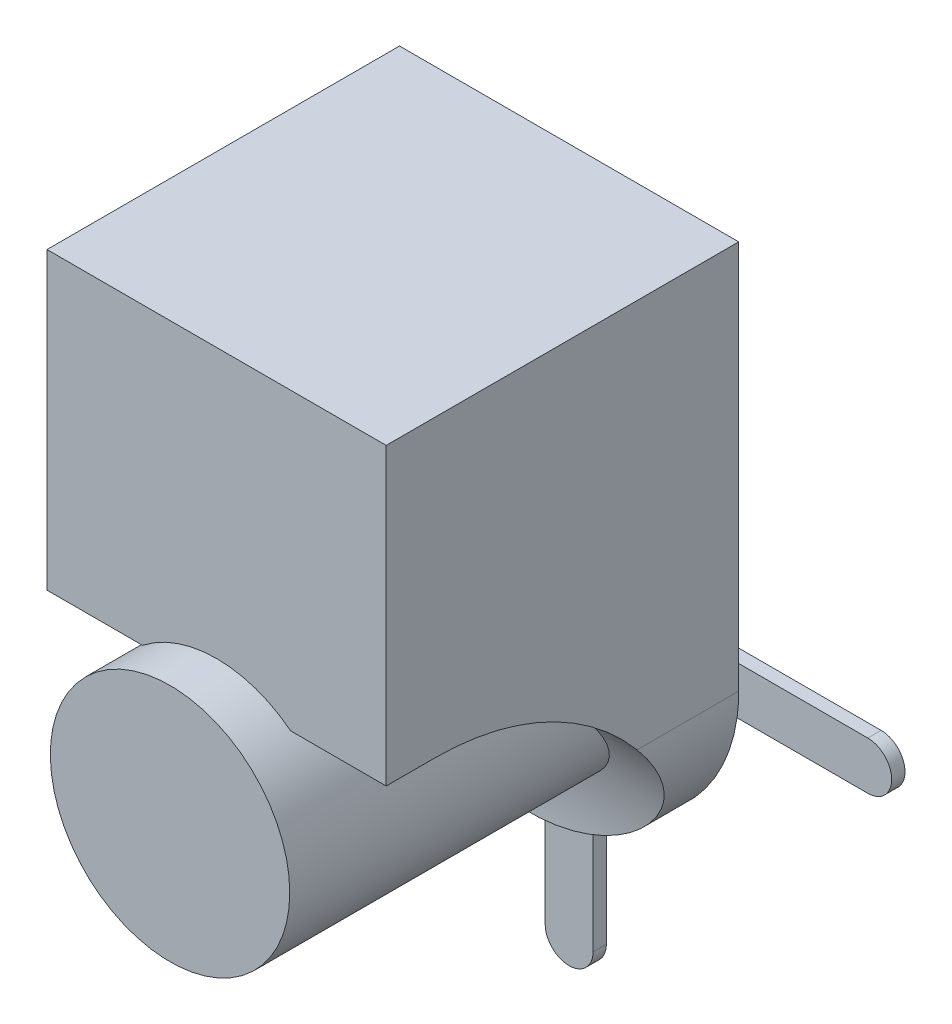
from build123d import *

# Parameters (mm, degrees)
SKETCH2_R               = 18
BOSS_EXTRUDE1_DEPTH     = 60
BOSS_EXTRUDE2_DEPTH     = 53
BOSS_EXTRUDE3_DEPTH     = 2
CUT_EXTRUDE3_DEPTH      = 97.822001632
CUT_EXTRUDE3_DEPTH_BACK = 97.822001632
BOSS_EXTRUDE4_START     = -56
SKETCH6_R               = 18
BOSS_EXTRUDE4_DEPTH     = 56


with BuildPart() as part:
    # Sketch2 → Boss-Extrude1 (new body)
    with BuildSketch(Plane.XY):
        Circle(SKETCH2_R)
    extrude(amount=BOSS_EXTRUDE1_DEPTH)

    # Sketch3 → Boss-Extrude2 (add)
    with BuildSketch(Plane.XY):
        with BuildLine():
            Line((-25.5, 0), (-25.5, 58.5))
            Line((-25.5, 58.5), (25.5, 58.5))
            Line((25.5, 58.5), (25.5, 0))
            ThreePointArc((25.5, 0), (0, -25.5), (-25.5, 0))
        make_face()
    extrude(amount=BOSS_EXTRUDE2_DEPTH)

    # Sketch4 → Boss-Extrude3 (add)
    with BuildSketch(Plane.XY):
        with BuildLine():
            Line((-3.6, 19.027416998), (-19.027416998, 3.6))
            Line((-19.027416998, 3.6), (-44.9, 3.6))
            ThreePointArc((-44.9, 3.6), (-48.5, 0), (-44.9, -3.6))
            Line((-44.9, -3.6), (-19.027416998, -3.6))
            Line((-19.027416998, -3.6), (-3.6, -19.027416998))
            Line((-3.6, -19.027416998), (-3.6, -44.9))
            ThreePointArc((-3.6, -44.9), (0, -48.5), (3.6, -44.9))
            Line((3.6, -44.9), (3.6, -19.027416998))
            Line((3.6, -19.027416998), (19.027416998, -3.6))
            Line((19.027416998, -3.6), (44.9, -3.6))
            ThreePointArc((44.9, -3.6), (48.5, 0), (44.9, 3.6))
            Line((44.9, 3.6), (19.027416998, 3.6))
            Line((19.027416998, 3.6), (3.6, 19.027416998))
            Line((3.6, 19.027416998), (3.6, 44.9))
            ThreePointArc((3.6, 44.9), (0, 48.5), (-3.6, 44.9))
            Line((-3.6, 44.9), (-3.6, 19.027416998))
        make_face()
    extrude(amount=-BOSS_EXTRUDE3_DEPTH)

    # Sketch5 → Cut-Extrude3 (cut, two sides: drawn at the far end of the back side and taken through both)
    with BuildSketch(Plane(origin=(0, 0, 0), x_dir=(0, 0, -1), z_dir=(1, 0, 0)).offset(-CUT_EXTRUDE3_DEPTH_BACK)):
        with BuildLine():
            Line((-53, 14.147312787), (-45.647312787, 14.147312787))
            ThreePointArc((-45.647312787, 14.147312787), (-17.612429059, 2.534883727), (-6, -25.5))
            Line((-6, -25.5), (-53, -25.5))
            Line((-53, -25.5), (-53, 14.147312787))
        make_face()
    extrude(amount=CUT_EXTRUDE3_DEPTH + CUT_EXTRUDE3_DEPTH_BACK, mode=Mode.SUBTRACT)

    # Sketch6 → Boss-Extrude4 (add)
    with BuildSketch(Plane.XY.offset(60).offset(BOSS_EXTRUDE4_START)):
        Circle(SKETCH6_R)
    extrude(amount=BOSS_EXTRUDE4_DEPTH)


solid = part.part
